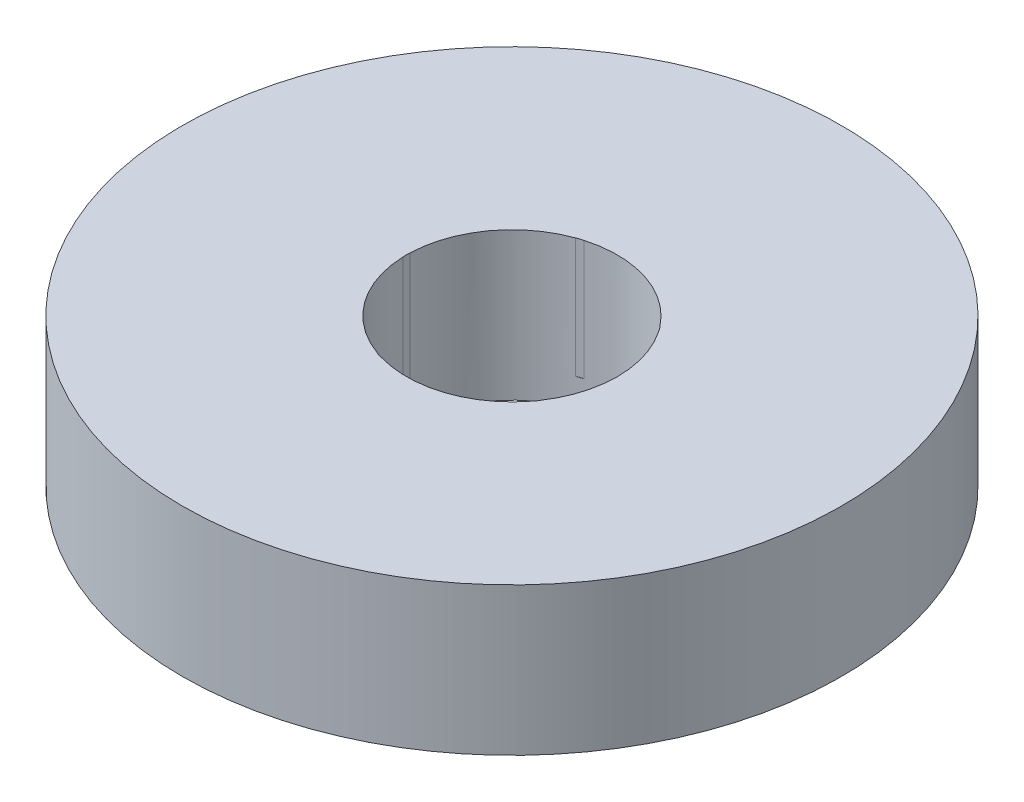
from build123d import *

# Parameters (mm, degrees)
SKETCH1_R           = 62.5
BOSS_EXTRUDE1_DEPTH = 28
SKETCH2_R           = 20
CUT_EXTRUDE1_DEPTH  = 93.717312299
SKETCH3_R           = 4.792188025
CUT_EXTRUDE2_DEPTH  = 22.735638951
CIRPATTERN1_COUNT   = 5


with BuildPart() as part:
    # Sketch1 → Boss-Extrude1 (new body)
    with BuildSketch(Plane(origin=(0, 0, 0), x_dir=(1, 0, 0), z_dir=(0, 1, 0))):
        Circle(SKETCH1_R)
    extrude(amount=BOSS_EXTRUDE1_DEPTH)

    # Sketch2 → Cut-Extrude1 (cut, through all)
    with BuildSketch(Plane(origin=(0, 0, 0), x_dir=(1, 0, 0), z_dir=(0, 1, 0))):
        Circle(SKETCH2_R)
    extrude(amount=CUT_EXTRUDE1_DEPTH, mode=Mode.SUBTRACT)

    # Sketch3 → Cut-Extrude2 (cut)
    with BuildSketch(Plane(origin=(0, 28, 0), x_dir=(1, 0, 0), z_dir=(0, 1, 0))):
        with Locations((-15.241500266, 0)):
            Circle(SKETCH3_R)
    cut_extrude2 = extrude(amount=-CUT_EXTRUDE2_DEPTH, mode=Mode.SUBTRACT)

    # CirPattern1: Cut-Extrude2 ×5 about axis
    cirpattern1_axis = Axis((0, 0, 0), (0, 1, 0))
    for i in range(1, CIRPATTERN1_COUNT):
        add(cut_extrude2.rotate(cirpattern1_axis, i * 360 / CIRPATTERN1_COUNT), mode=Mode.SUBTRACT)


solid = part.part
